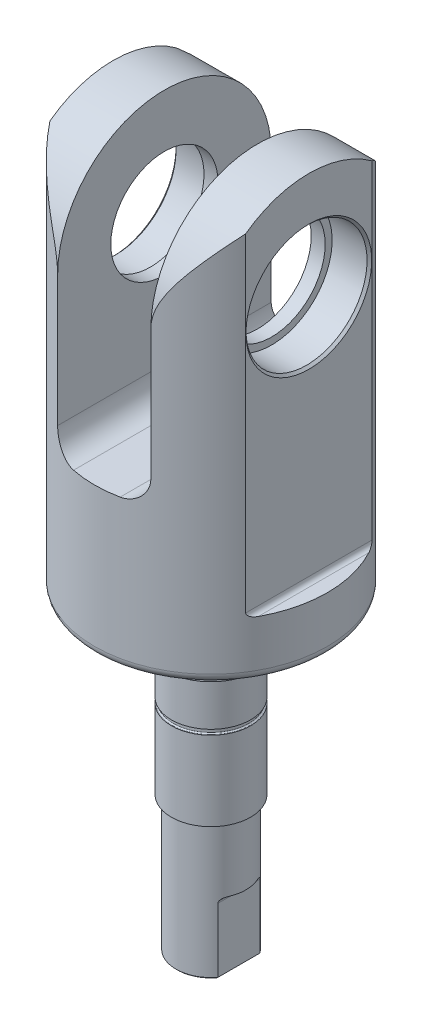
from build123d import *

# Parameters (mm, degrees)
BOSS_EXTRUDE1_DEPTH       = 12
BOSS_EXTRUDE2_DEPTH       = 80
FILLET1_R                 = 10
CUT_EXTRUDE5_DEPTH        = 99.55962662266938
CUT_EXTRUDE5_DEPTH_BACK   = 99.55962662266938
SKETCH9_R                 = 35.52790528146086
SKETCH9_R_2               = 25
CUT_EXTRUDE1_DEPTH        = 50
BOSS_EXTRUDE3_DEPTH       = 20
SKETCH8_R                 = 1.0000000000000018
SKETCH8_R_2               = 1.0000000000000002
CUT_EXTRUDE4_DEPTH        = 5
FILLET5_R                 = 1
FILLET6_R                 = 5
SKETCH10_R                = 11.499999999999998
CUT_EXTRUDE6_DEPTH        = 103.32142607246962
SKETCH11_R                = 13.000000000000002
CUT_EXTRUDE7_DEPTH        = 8
FILLET8_R                 = 0.25
CUT_EXTRUDE8_START        = -15
CUT_EXTRUDE8_DEPTH        = 15
FILLET9_R                 = 1
FILLET10_R                = 5
CHAMFER1_SIZE             = 0.25
F_4_0MM_DOWEL_HOLE1_D     = 4
F_4_0MM_DOWEL_HOLE1_DEPTH = 20
F_4_0MM_DOWEL_HOLE1_TIP   = 1.2017212380551205
M4X0_7_TAPPED_HOLE1_D     = 3.3
M4X0_7_TAPPED_HOLE1_DEPTH = 11.5
M4X0_7_TAPPED_HOLE1_TIP   = 0.9914200213954745
CHAMFER2_SIZE             = 0.5


with BuildPart() as part:
    # Sketch1 → Boss-Extrude1 (new body)
    with BuildSketch(Plane(origin=(0, 0, 0), x_dir=(1, 0, 0), z_dir=(0, 1, 0))):
        with BuildLine():
            ThreePointArc((17.083333333333336, 18.252663428174593), (-25.000000000000004, 3.06e-15), (17.083333333333336, -18.252663428174593))
            ThreePointArc((17.083333333333336, -18.252663428174593), (25.000000000000004, 0), (17.083333333333336, 18.252663428174593))
        make_face()
    extrude(amount=BOSS_EXTRUDE1_DEPTH)

    # Sketch2 → Boss-Extrude2 (add)
    with BuildSketch(Plane(origin=(0, 12, 0), x_dir=(1, 0, 0), z_dir=(0, 1, 0))):
        Polygon((-21, -25), (-10.000000000000004, -25), (-9.99999999999999, 25), (-21, 24.999999999999993), align=None)
        Polygon((9.999999999999995, -25.000000000000007), (20.999999999999993, -25.000000000000007), (20.999999999999993, 24.999999999999993), (9.999999999999998, 24.999999999999993), align=None)
    extrude(amount=BOSS_EXTRUDE2_DEPTH)

    # Fillet1
    fillet1_edges = [part.edges().sort_by_distance(p)[0] for p in [
        (-15.499999999999995, 92, -24.999999999999996),
        (-15.500000000000002, 92, 25),
        (15.499999999999996, 92, -24.999999999999993),
        (15.499999999999993, 92, 25.000000000000007),
    ]]
    fillet(fillet1_edges, radius=FILLET1_R)

    # Sketch9 → Cut-Extrude5 (cut, two sides: drawn at the far end of the back side and taken through both)
    with BuildSketch(Plane(origin=(0, 0, 0), x_dir=(1, 0, 0), z_dir=(0, 1, 0)).offset(-CUT_EXTRUDE5_DEPTH_BACK)):
        Circle(SKETCH9_R)
        with Locations(Location((0, 0, 0), (0, 0, 113.578178478))):
            Circle(SKETCH9_R_2, mode=Mode.SUBTRACT)
    extrude(amount=CUT_EXTRUDE5_DEPTH + CUT_EXTRUDE5_DEPTH_BACK, mode=Mode.SUBTRACT)

    # Sketch4 → Cut-Extrude1 (cut)
    with BuildSketch(Plane.ZY.offset(21)):
        with BuildLine():
            Line((-22.912878474779195, 65), (-31.15503377709483, 65))
            Line((-31.15503377709483, 65), (-31.15503377709483, 113.2535674059588))
            Line((-31.15503377709483, 113.2535674059588), (29.53442081259816, 113.2535674059588))
            Line((29.53442081259816, 113.2535674059588), (29.534420812598167, 65.00000000000001))
            Line((29.534420812598167, 65.00000000000001), (22.912878474779195, 65))
            ThreePointArc((22.912878474779195, 65), (1.4e-15, 87.91287847477919), (-22.912878474779195, 65))
        make_face()
    extrude(amount=-CUT_EXTRUDE1_DEPTH, mode=Mode.SUBTRACT)

    # Sketch6 → Boss-Extrude3 (add)
    with BuildSketch(Plane(origin=(0, 12, 0), x_dir=(1, 0, 0), z_dir=(0, 1, 0))):
        with BuildLine():
            Line((9.999999999999998, -22.9128784747792), (9.999999999999998, 22.9128784747792))
            ThreePointArc((9.999999999999998, 22.9128784747792), (1.53e-15, 24.999999999999996), (-9.999999999999995, 22.9128784747792))
            Line((-9.999999999999995, 22.9128784747792), (-9.999999999999995, -22.9128784747792))
            ThreePointArc((-9.999999999999995, -22.9128784747792), (1.53e-15, -24.999999999999996), (9.999999999999998, -22.9128784747792))
        make_face()
    extrude(amount=BOSS_EXTRUDE3_DEPTH)

    # Sketch8 → Cut-Extrude4 (cut)
    with BuildSketch(Plane.ZY.offset(21)):
        with Locations((-10.999999999999996, 20)):
            Circle(SKETCH8_R)
        with Locations((0, 19.999999999999996)):
            Circle(SKETCH8_R_2)
        with Locations((11, 19.999999999999996)):
            Circle(SKETCH8_R)
    extrude(amount=-CUT_EXTRUDE4_DEPTH, mode=Mode.SUBTRACT)

    # Fillet5
    # the kernel refuses this fillet: 1 mm, written as the material it adds along each edge
    with BuildSketch(Plane(origin=(-21, 12, -16.064659966249277), x_dir=(0, 1, 0), z_dir=(0, 0, 1))) as fillet5_piece_1_section:
        with BuildLine():
            CenterArc((FILLET5_R, FILLET5_R), FILLET5_R, 180, 90)
            Line((0, FILLET5_R), (0, 0))
            Line((0, 0), (FILLET5_R, 0))
        make_face()
    fillet5_piece_1 = extrude(amount=32.12931993250112, mode=Mode.PRIVATE)
    fillet5_piece_1 = fillet5_piece_1 & Plane(origin=(0, 12, 0), x_dir=(-0.3999999999967713, 0, -0.9165151389925771), z_dir=(0, -1, 0)) * Cylinder(25, 69, mode=Mode.PRIVATE)
    add(fillet5_piece_1)
    with BuildSketch(Plane(origin=(20.999999999999993, 12, 16.064659966250236), x_dir=(0, 1, 0), z_dir=(0, 0, -1))) as fillet5_piece_2_section:
        with BuildLine():
            CenterArc((FILLET5_R, FILLET5_R), FILLET5_R, 180, 90)
            Line((0, FILLET5_R), (0, 0))
            Line((0, 0), (FILLET5_R, 0))
        make_face()
    fillet5_piece_2 = extrude(amount=32.12931993250051, mode=Mode.PRIVATE)
    fillet5_piece_2 = fillet5_piece_2 & Plane(origin=(0, 12, 0), x_dir=(-0.3999999999967713, 0, -0.9165151389925771), z_dir=(0, -1, 0)) * Cylinder(25, 69, mode=Mode.PRIVATE)
    add(fillet5_piece_2)

    # Fillet6
    # the kernel refuses this fillet: 5 mm, written as the material it adds along each edge
    with BuildSketch(Plane(origin=(-9.999999999999995, 32, -35.4128784747792), x_dir=(1, 0, 0), z_dir=(0, 0, 1))) as fillet6_piece_1_section:
        with BuildLine():
            CenterArc((FILLET6_R, FILLET6_R), FILLET6_R, 180, 90)
            Line((-1.78e-15, FILLET6_R), (0, 0))
            Line((0, 0), (FILLET6_R, 0))
        make_face()
    fillet6_piece_1 = extrude(amount=70.8257569495584, mode=Mode.PRIVATE)
    fillet6_piece_1 = fillet6_piece_1 & Plane(origin=(0, 32, 0), x_dir=(-0.3999999999967713, 0, -0.9165151389925771), z_dir=(0, -1, 0)) * Cylinder(25, 162, mode=Mode.PRIVATE)
    add(fillet6_piece_1)
    with BuildSketch(Plane(origin=(9.999999999999998, 32, 35.4128784747792), x_dir=(-3.6e-16, 1, 0), z_dir=(0, 0, -1))) as fillet6_piece_2_section:
        with BuildLine():
            CenterArc((FILLET6_R, -FILLET6_R), FILLET6_R, 90.00000000000003, 89.99999999999997)
            Line((1.78e-15, -FILLET6_R), (0, 0))
            Line((0, 0), (FILLET6_R, 0))
        make_face()
    fillet6_piece_2 = extrude(amount=70.8257569495584, mode=Mode.PRIVATE)
    fillet6_piece_2 = fillet6_piece_2 & Plane(origin=(0, 32, 0), x_dir=(-0.3999999999967713, 0, -0.9165151389925771), z_dir=(0, -1, 0)) * Cylinder(25, 162, mode=Mode.PRIVATE)
    add(fillet6_piece_2)

    # Sketch10 → Cut-Extrude6 (cut, through all)
    with BuildSketch(Plane.ZY.offset(21)):
        with Locations((0, 65)):
            Circle(SKETCH10_R)
    extrude(amount=-CUT_EXTRUDE6_DEPTH, mode=Mode.SUBTRACT)

    # Sketch11 → Cut-Extrude7 (cut)
    with BuildSketch(Plane.ZY.offset(21)):
        with Locations((0, 65)):
            Circle(SKETCH11_R)
    cut_extrude7 = extrude(amount=-CUT_EXTRUDE7_DEPTH, mode=Mode.SUBTRACT)

    # Mirror1: Cut-Extrude7 across plane
    add(cut_extrude7.mirror(Plane(origin=(0, 0, 0), x_dir=(0, 0, 1), z_dir=(1, 0, 0))), mode=Mode.SUBTRACT)

    # Sketch12 → Revolve1 (revolve)
    with BuildSketch(Plane(origin=(0, 0, 0), x_dir=(0, 0, -1), z_dir=(1, 0, 0))):
        Polygon((-9.999999999999995, 0), (0, 0), (9.54e-15, -67), (-7.49999999999999, -67), (-7.499999999999994, -38), (-8.499999999999998, -38), (-8.499999999999998, -20.999999999999996), (-8.1, -20.999999999999996), (-8.099999999999998, -19.9), (-8.499999999999998, -19.900000000000002), (-8.5, -10), (-10.000000000000002, -10), align=None)
    revolve(axis=Axis((0, 12.111975574510412, 0), (0, -1, 0)))

    # Fillet7: read off the stored shape, not the designer's step
    # Fillet7 outline → Fillet7 (revolve, cut)
    with BuildSketch(Plane.XY):
        with BuildLine():
            ThreePointArc((25, 2), (24.414213562, 0.585786438), (23, 0))
            Line((23, 0), (25, 0))
            Line((25, 0), (25, 2))
        make_face()
    revolve(axis=Axis((0, 0, 0), (0, 1, 0)), mode=Mode.SUBTRACT)

    # Fillet8
    fillet8_edges = [part.edges().sort_by_distance(p)[0] for p in [
        (-9.9e-16, -19.9, -8.099999999999998),
        (-1.04e-15, -9.999999999999998, -8.5),
        (-9.2e-16, -38, -7.499999999999994),
        (-9.9e-16, -21, -8.1),
    ]]
    fillet(fillet8_edges, radius=FILLET8_R)

    # Sketch13 → Cut-Extrude8 (cut)
    with BuildSketch(Plane.XZ.offset(67).offset(CUT_EXTRUDE8_START)):
        with BuildLine():
            Line((-6, -4.500000000000001), (-6, 4.500000000000001))
            ThreePointArc((-6, 4.500000000000001), (-7.500000000000001, 9.2e-16), (-6, -4.500000000000001))
        make_face()
        with BuildLine():
            Line((6, -4.500000000000001), (6, 4.500000000000001))
            ThreePointArc((6, 4.500000000000001), (7.500000000000001, 0), (6, -4.500000000000001))
        make_face()
    extrude(amount=CUT_EXTRUDE8_DEPTH, mode=Mode.SUBTRACT)

    # Fillet9
    fillet9_edges = [part.edges().sort_by_distance(p)[0] for p in [
        (6, -52, 0),
        (-6, -52, 0),
    ]]
    fillet(fillet9_edges, radius=FILLET9_R)

    # Fillet10
    fillet10_edges = [part.edges().sort_by_distance(p)[0] for p in [
        (-1.22e-15, 0, -9.999999999999995),
    ]]
    fillet(fillet10_edges, radius=FILLET10_R)

    # Chamfer1
    chamfer1_edges = [part.edges().sort_by_distance(p)[0] for p in [
        (-9.2e-16, -67, -7.49999999999999),
        (3.354101966249682, -67, 6.70820393249936),
        (6, -67, 0),
        (-6, -67, 0),
    ]]
    chamfer(chamfer1_edges, length=CHAMFER1_SIZE)

    # Ø4.0mm Dowel Hole1
    with Locations(Plane.ZY.offset(21)):
        with Locations((-11, 20), (11, 20)):
            Hole(F_4_0MM_DOWEL_HOLE1_D / 2, depth=F_4_0MM_DOWEL_HOLE1_DEPTH)
            with Locations((0, 0, -(F_4_0MM_DOWEL_HOLE1_DEPTH + F_4_0MM_DOWEL_HOLE1_TIP / 2))):  # 118° drill point
                Cone(0, F_4_0MM_DOWEL_HOLE1_D / 2, F_4_0MM_DOWEL_HOLE1_TIP, mode=Mode.SUBTRACT)

    # M4x0.7 Tapped Hole1
    with Locations(Plane.ZY.offset(21)):
        with Locations((0, 20)):
            Hole(M4X0_7_TAPPED_HOLE1_D / 2, depth=M4X0_7_TAPPED_HOLE1_DEPTH)
            with Locations((0, 0, -(M4X0_7_TAPPED_HOLE1_DEPTH + M4X0_7_TAPPED_HOLE1_TIP / 2))):  # 118° drill point
                Cone(0, M4X0_7_TAPPED_HOLE1_D / 2, M4X0_7_TAPPED_HOLE1_TIP, mode=Mode.SUBTRACT)

    # Chamfer2
    chamfer2_edges = [part.edges().sort_by_distance(p)[0] for p in [
        (-21, 65, -13.000000000000002),
        (21, 65, -13.000000000000002),
    ]]
    chamfer(chamfer2_edges, length=CHAMFER2_SIZE)


solid = part.part
